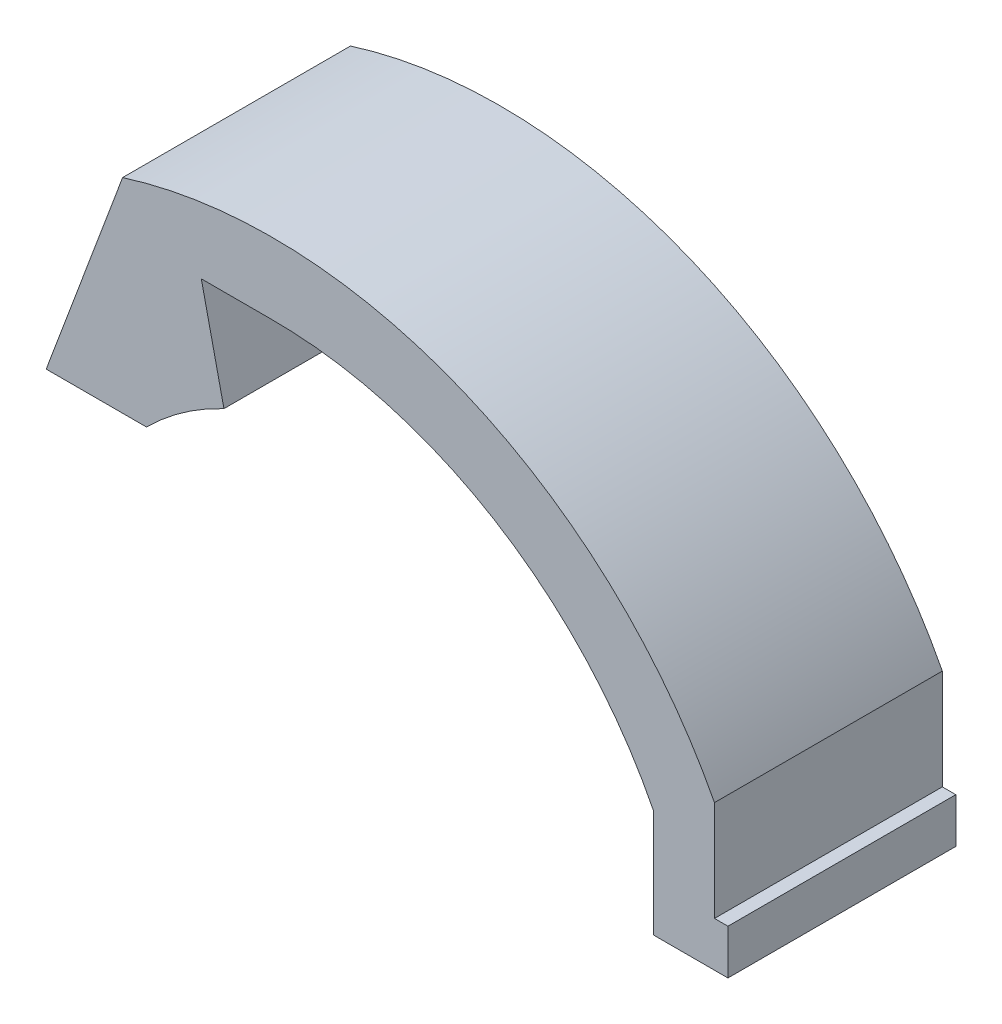
from build123d import *

# Parameters (mm, degrees)
BOSS_EXTRUDE2_DEPTH = 12.7


with BuildPart() as part:
    # Sketch2 → Boss-Extrude2 (new body)
    with BuildSketch(Plane.XY):
        with BuildLine():
            Line((-36.978601724, 13.784983701), (-38.2399832, 19.423702061))
            Line((-38.2399832, 19.423702061), (-34.4899832, 19.423702061))
            ThreePointArc((-34.4899832, 19.423702061), (-21.896691805, 15.95065026), (-13.037764583, 6.35))
            Line((-13.037764583, 6.35), (-13.037764583, 0.35))
            Line((-13.037764583, 0.35), (-11.412456608, 0.35))
            Line((-11.412456608, 0.35), (-8.887638498, 0.35))
            Line((-8.887638498, 0.35), (-8.887638498, 2.85))
            Line((-8.887638498, 2.85), (-9.637638498, 2.85))
            Line((-9.637638498, 2.85), (-9.637638498, 8.440362277))
            ThreePointArc((-9.637638498, 8.440362277), (-23.640693764, 21.287194603), (-42.625885084, 22.11735613))
            Line((-42.625885084, 22.11735613), (-46.884786338, 10.740666392))
            Line((-46.884786338, 10.740666392), (-41.291830809, 10.740666392))
            ThreePointArc((-41.291830809, 10.740666392), (-39.268045038, 12.451018609), (-36.978601724, 13.784983701))
        make_face()
    extrude(amount=-BOSS_EXTRUDE2_DEPTH)


solid = part.part
